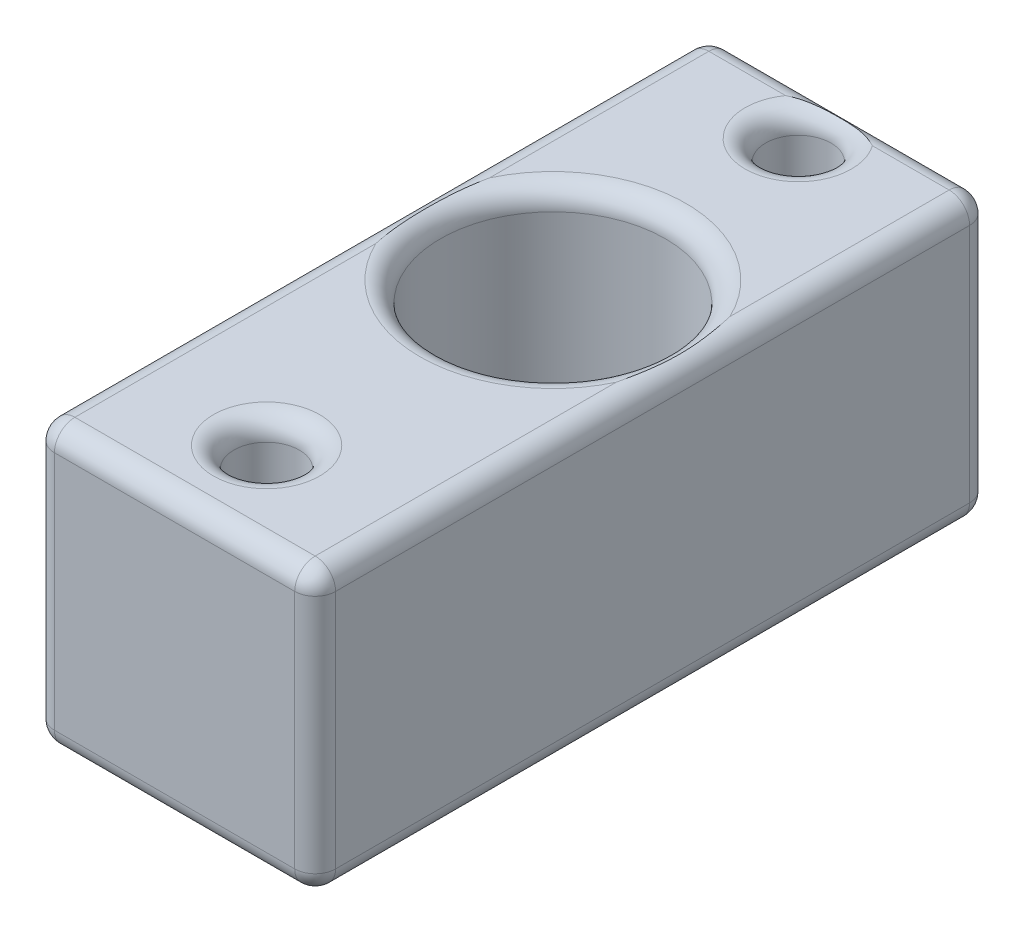
from build123d import *

# Parameters (mm, degrees)
BOSS_EXTRUDE1_DEPTH      = 18
BOSS_EXTRUDE1_DEPTH_BACK = 15
SKETCH1_W                = 13.75
SKETCH1_H                = 13.75
CUT_EXTRUDE1_DEPTH       = 10
CUT_EXTRUDE1_DEPTH_BACK  = 10
SKETCH2_R                = 1.6
SKETCH2_R_2              = 5.5
FILLET1_R                = 1


with BuildPart() as part:
    # Sketch1 → Boss-Extrude1 (new, two sides: drawn at the far end of the back side and taken through both)
    with BuildSketch(Plane.XY.offset(-BOSS_EXTRUDE1_DEPTH_BACK)):
        Rectangle(SKETCH1_W, SKETCH1_H)
    extrude(amount=BOSS_EXTRUDE1_DEPTH + BOSS_EXTRUDE1_DEPTH_BACK)

    # Sketch2 → Cut-Extrude1 (cut, two sides: drawn at the far end of the back side and taken through both)
    with BuildSketch(Plane(origin=(0, 0, 0), x_dir=(1, 0, 0), z_dir=(0, 1, 0)).offset(-CUT_EXTRUDE1_DEPTH_BACK)):
        with Locations(Location((0, 12.5, 0), (0, 0, 90))):
            Circle(SKETCH2_R)
        with Locations(Location((0, -13.5, 0), (0, 0, 90))):
            Circle(SKETCH2_R)
        with Locations(Location((0, 0.5, 0), (0, 0, 90))):
            Circle(SKETCH2_R_2)
    extrude(amount=CUT_EXTRUDE1_DEPTH + CUT_EXTRUDE1_DEPTH_BACK, mode=Mode.SUBTRACT)

    # Fillet1
    # the kernel refuses this fillet: 1 mm, written as the material it takes off along each edge
    with BuildSketch(Plane(origin=(5.875, -5.875, 17), x_dir=(1, 0, 0), z_dir=(0, -1, 0))) as fillet1_piece_1_section:
        Polygon((0, 0), (FILLET1_R, 0), (FILLET1_R, FILLET1_R), (0, FILLET1_R), align=None)
    fillet1_piece_1 = extrude(amount=FILLET1_R, mode=Mode.PRIVATE)
    fillet1_piece_1 = fillet1_piece_1 - Plane(origin=(5.875, -5.875, 17), x_dir=(-0.7071067811865475, 0, -0.7071067811865475), z_dir=(0, -1, 0)) * Sphere(FILLET1_R, mode=Mode.PRIVATE)
    add(fillet1_piece_1, mode=Mode.SUBTRACT)
    with BuildSketch(Plane(origin=(5.875, 5.875, 17), x_dir=(1, 0, 0), z_dir=(0, 1, 0))) as fillet1_piece_2_section:
        Polygon((0, 0), (FILLET1_R, 0), (FILLET1_R, -FILLET1_R), (0, -FILLET1_R), align=None)
    fillet1_piece_2 = extrude(amount=FILLET1_R, mode=Mode.PRIVATE)
    fillet1_piece_2 = fillet1_piece_2 - Plane(origin=(5.875, 5.875, 17), x_dir=(-0.7071067811865475, 0, -0.7071067811865475), z_dir=(0, 1, 0)) * Sphere(FILLET1_R, mode=Mode.PRIVATE)
    add(fillet1_piece_2, mode=Mode.SUBTRACT)
    with BuildSketch(Plane(origin=(-5.875, 5.875, -14), x_dir=(0, 1, 0), z_dir=(-1, 0, 0))) as fillet1_piece_3_section:
        Polygon((0, 0), (FILLET1_R, 0), (FILLET1_R, FILLET1_R), (0, FILLET1_R), align=None)
    fillet1_piece_3 = extrude(amount=FILLET1_R, mode=Mode.PRIVATE)
    fillet1_piece_3 = fillet1_piece_3 - Plane(origin=(-5.875, 5.875, -14), x_dir=(0, -0.7071067811865475, 0.7071067811865475), z_dir=(-1, 0, 0)) * Sphere(FILLET1_R, mode=Mode.PRIVATE)
    add(fillet1_piece_3, mode=Mode.SUBTRACT)
    with BuildSketch(Plane(origin=(-5.875, -5.875, -14), x_dir=(0, -1, 0), z_dir=(-1, 0, 0))) as fillet1_piece_4_section:
        Polygon((0, 0), (FILLET1_R, 0), (FILLET1_R, -FILLET1_R), (0, -FILLET1_R), align=None)
    fillet1_piece_4 = extrude(amount=FILLET1_R, mode=Mode.PRIVATE)
    fillet1_piece_4 = fillet1_piece_4 - Plane(origin=(-5.875, -5.875, -14), x_dir=(0, 0.7071067811865475, 0.7071067811865475), z_dir=(-1, 0, 0)) * Sphere(FILLET1_R, mode=Mode.PRIVATE)
    add(fillet1_piece_4, mode=Mode.SUBTRACT)
    with BuildSketch(Plane(origin=(-5.875, 5.875, 17), x_dir=(0, 1, 0), z_dir=(-1, 0, 0))) as fillet1_piece_5_section:
        Polygon((0, 0), (FILLET1_R, 0), (FILLET1_R, -FILLET1_R), (0, -FILLET1_R), align=None)
    fillet1_piece_5 = extrude(amount=FILLET1_R, mode=Mode.PRIVATE)
    fillet1_piece_5 = fillet1_piece_5 - Plane(origin=(-5.875, 5.875, 17), x_dir=(0, -0.7071067811865475, -0.7071067811865475), z_dir=(-1, 0, 0)) * Sphere(FILLET1_R, mode=Mode.PRIVATE)
    add(fillet1_piece_5, mode=Mode.SUBTRACT)
    with BuildSketch(Plane(origin=(-5.875, -5.875, 17), x_dir=(0, -1, 0), z_dir=(-1, 0, 0))) as fillet1_piece_6_section:
        Polygon((0, 0), (FILLET1_R, 0), (FILLET1_R, FILLET1_R), (0, FILLET1_R), align=None)
    fillet1_piece_6 = extrude(amount=FILLET1_R, mode=Mode.PRIVATE)
    fillet1_piece_6 = fillet1_piece_6 - Plane(origin=(-5.875, -5.875, 17), x_dir=(0, 0.7071067811865475, -0.7071067811865475), z_dir=(-1, 0, 0)) * Sphere(FILLET1_R, mode=Mode.PRIVATE)
    add(fillet1_piece_6, mode=Mode.SUBTRACT)
    with BuildSketch(Plane(origin=(5.875, -5.875, -14), x_dir=(1, 0, 0), z_dir=(0, -1, 0))) as fillet1_piece_7_section:
        Polygon((0, 0), (FILLET1_R, 0), (FILLET1_R, -FILLET1_R), (0, -FILLET1_R), align=None)
    fillet1_piece_7 = extrude(amount=FILLET1_R, mode=Mode.PRIVATE)
    fillet1_piece_7 = fillet1_piece_7 - Plane(origin=(5.875, -5.875, -14), x_dir=(-0.7071067811865475, 0, 0.7071067811865475), z_dir=(0, -1, 0)) * Sphere(FILLET1_R, mode=Mode.PRIVATE)
    add(fillet1_piece_7, mode=Mode.SUBTRACT)
    with BuildSketch(Plane(origin=(5.875, 5.875, -14), x_dir=(1, 0, 0), z_dir=(0, 1, 0))) as fillet1_piece_8_section:
        Polygon((0, 0), (FILLET1_R, 0), (FILLET1_R, FILLET1_R), (0, FILLET1_R), align=None)
    fillet1_piece_8 = extrude(amount=FILLET1_R, mode=Mode.PRIVATE)
    fillet1_piece_8 = fillet1_piece_8 - Plane(origin=(5.875, 5.875, -14), x_dir=(-0.7071067811865475, 0, 0.7071067811865475), z_dir=(0, 1, 0)) * Sphere(FILLET1_R, mode=Mode.PRIVATE)
    add(fillet1_piece_8, mode=Mode.SUBTRACT)
    with BuildSketch(Plane(origin=(6.875, -5.875, 18), x_dir=(0, 0, -1), z_dir=(0, 1, 0)), Plane(origin=(-6.875, 5.875, -15), x_dir=(1, 0, 0), z_dir=(0, -1, 0)), Plane(origin=(5.875, 6.875, 18), x_dir=(0, 0, -1), z_dir=(-1, 0, 0)), Plane(origin=(-5.875, -6.875, 18), x_dir=(0, 0, -1), z_dir=(1, 0, 0))) as fillet1_piece_9:
        with BuildLine():
            CenterArc((FILLET1_R, FILLET1_R), FILLET1_R, 180, 90)
            Line((0, FILLET1_R), (0, 0))
            Line((0, 0), (FILLET1_R, 0))
        make_face()
    extrude(amount=11.75, mode=Mode.SUBTRACT)
    with BuildSketch(Plane(origin=(-6.875, 5.875, 18), x_dir=(1, 0, 0), z_dir=(0, -1, 0)), Plane(origin=(-5.875, -6.875, -15), x_dir=(0, 0, 1), z_dir=(1, 0, 0)), Plane(origin=(6.875, -5.875, -15), x_dir=(0, 0, 1), z_dir=(0, 1, 0)), Plane(origin=(5.875, 6.875, -15), x_dir=(0, 0, 1), z_dir=(-1, 0, 0))) as fillet1_piece_10:
        with BuildLine():
            CenterArc((FILLET1_R, -FILLET1_R), FILLET1_R, 90, 90)
            Line((0, -FILLET1_R), (0, 0))
            Line((0, 0), (FILLET1_R, 0))
        make_face()
    extrude(amount=11.75, mode=Mode.SUBTRACT)
    with BuildSketch(Plane(origin=(0, -6.875, 13.5), x_dir=(0, 0, -1), z_dir=(1, 0, 0))) as fillet1_piece_11:
        with BuildLine():
            CenterArc((1.6 + FILLET1_R, FILLET1_R), FILLET1_R, 180, 90)
            Line((1.6, FILLET1_R), (1.6, 0))
            Line((1.6, 0), (1.6 + FILLET1_R, 0))
        make_face()
    revolve(axis=Axis((0, -6.875, 13.5), (0, 1, 0)), mode=Mode.SUBTRACT)
    with BuildSketch(Plane(origin=(0, 6.875, 13.5), x_dir=(0, 0, -1), z_dir=(-1, 0, 0))) as fillet1_piece_12:
        with BuildLine():
            CenterArc((1.6 + FILLET1_R, FILLET1_R), FILLET1_R, 180, 90)
            Line((1.6, FILLET1_R), (1.6, 0))
            Line((1.6, 0), (1.6 + FILLET1_R, 0))
        make_face()
    revolve(axis=Axis((0, 6.875, 13.5), (0, -1, 0)), mode=Mode.SUBTRACT)
    with BuildSketch(Plane(origin=(0, -6.875, -0.5), x_dir=(0, 0, -1), z_dir=(1, 0, 0))) as fillet1_piece_13:
        with BuildLine():
            CenterArc((5.5 + FILLET1_R, FILLET1_R), FILLET1_R, 180, 90)
            Line((5.5, FILLET1_R), (5.5, 0))
            Line((5.5, 0), (5.5 + FILLET1_R, 0))
        make_face()
    revolve(axis=Axis((0, -6.875, -0.5), (0, 1, 0)), mode=Mode.SUBTRACT)
    with BuildSketch(Plane(origin=(0, 6.875, -0.5), x_dir=(0, 0, -1), z_dir=(-1, 0, 0))) as fillet1_piece_14:
        with BuildLine():
            CenterArc((5.5 + FILLET1_R, FILLET1_R), FILLET1_R, 180, 90)
            Line((5.5, FILLET1_R), (5.5, 0))
            Line((5.5, 0), (5.5 + FILLET1_R, 0))
        make_face()
    revolve(axis=Axis((0, 6.875, -0.5), (0, -1, 0)), mode=Mode.SUBTRACT)
    with BuildSketch(Plane(origin=(0, -6.875, -12.5), x_dir=(0, 0, -1), z_dir=(1, 0, 0))) as fillet1_piece_15:
        with BuildLine():
            CenterArc((1.6 + FILLET1_R, FILLET1_R), FILLET1_R, 180, 90)
            Line((1.6, FILLET1_R), (1.6, 0))
            Line((1.6, 0), (1.6 + FILLET1_R, 0))
        make_face()
    revolve(axis=Axis((0, -6.875, -12.5), (0, 1, 0)), mode=Mode.SUBTRACT)
    with BuildSketch(Plane(origin=(0, 6.875, -12.5), x_dir=(0, 0, -1), z_dir=(-1, 0, 0))) as fillet1_piece_16:
        with BuildLine():
            CenterArc((1.6 + FILLET1_R, FILLET1_R), FILLET1_R, 180, 90)
            Line((1.6 + FILLET1_R, 0), (1.6, 0))
            Line((1.6, 0), (1.6, FILLET1_R))
        make_face()
    revolve(axis=Axis((0, 6.875, -12.5), (0, -1, 0)), mode=Mode.SUBTRACT)
    with BuildSketch(Plane(origin=(6.875, -6.875, -14), x_dir=(-1, 0, 0), z_dir=(0, 0, 1)), Plane(origin=(-6.875, -6.875, 17), x_dir=(1, 0, 0), z_dir=(0, 0, -1))) as fillet1_piece_17:
        with BuildLine():
            CenterArc((FILLET1_R, -FILLET1_R), FILLET1_R, 90, 90)
            Line((0, -FILLET1_R), (0, 0))
            Line((0, 0), (FILLET1_R, 0))
        make_face()
    extrude(amount=31, mode=Mode.SUBTRACT)
    with BuildSketch(Plane(origin=(-6.875, 6.875, 17), x_dir=(1, 0, 0), z_dir=(0, 0, -1)), Plane(origin=(6.875, 6.875, -14), x_dir=(-1, 0, 0), z_dir=(0, 0, 1))) as fillet1_piece_18:
        with BuildLine():
            CenterArc((FILLET1_R, FILLET1_R), FILLET1_R, 180, 90)
            Line((0, FILLET1_R), (0, 0))
            Line((0, 0), (FILLET1_R, 0))
        make_face()
    extrude(amount=31, mode=Mode.SUBTRACT)


solid = part.part
